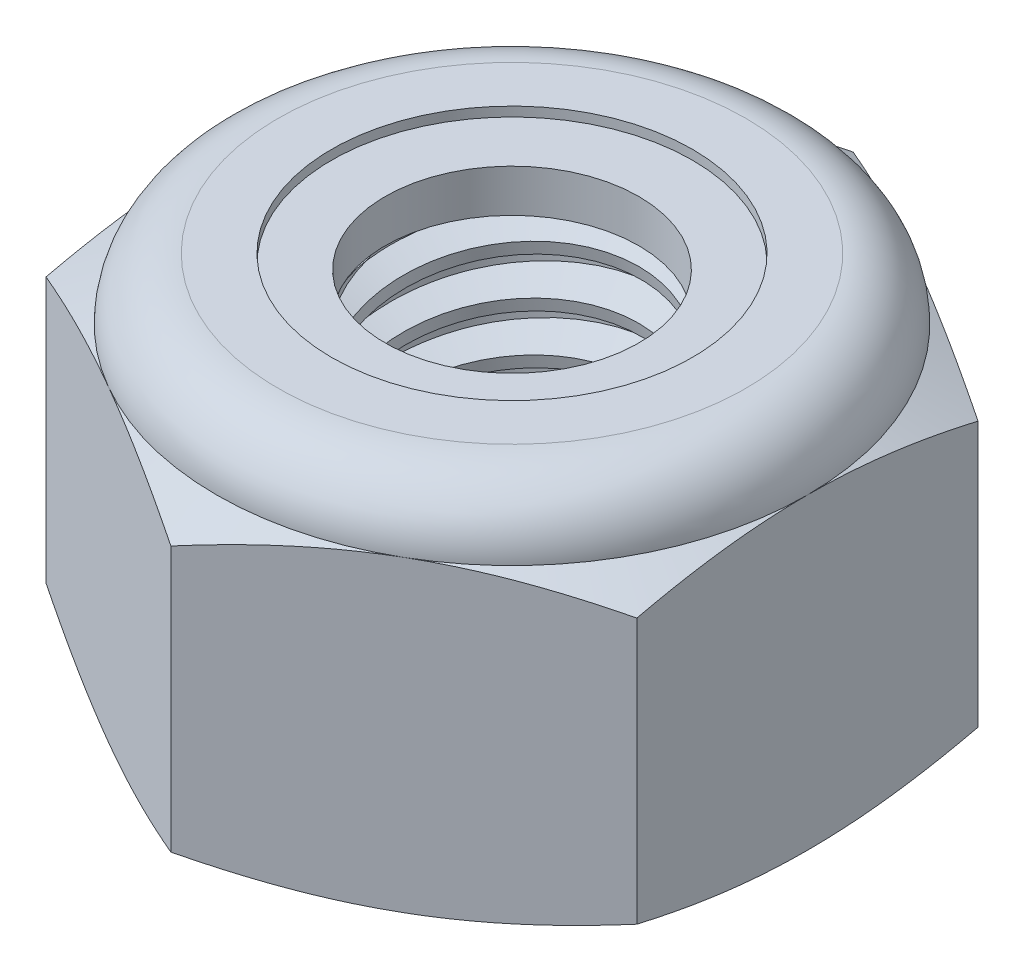
from build123d import *

# Parameters (mm, degrees)
EXTRUDE1_DEPTH       = 5.953125
SKETCH2_W            = 2.413
SKETCH2_H            = 5.953125
LPATTERN1_COUNT      = 8
LPATTERN1_PITCH      = 0.79375
LPATTERN1_COUNT_DIR2 = 2
LPATTERN1_PITCH_DIR2 = 0.79375


with BuildPart() as part:
    # Sketch1 → Extrude1 (new body)
    with BuildSketch(Plane(origin=(0, 0, 0), x_dir=(1, 0, 0), z_dir=(0, 1, 0))):
        Polygon((0, 5.499261314), (-4.7625, 2.749630657), (-4.7625, -2.749630657), (0, -5.499261314), (4.7625, -2.749630657), (4.7625, 2.749630657), align=None)
    extrude(amount=EXTRUDE1_DEPTH)

    # Sketch4 → Cut-Revolve2 (revolve, cut)
    with BuildSketch(Plane(origin=(0, 0, 0), x_dir=(0, 0, -1), z_dir=(1, 0, 0))):
        Polygon((0, 5.953125), (2.413, 5.953125), (2.045424837, 5.781721887), (2.045424837, 0.171403113), (2.413, 0), (0, 0), align=None)
    revolve(axis=Axis((0, 5.953125, 0), (0, 1, 0)), mode=Mode.SUBTRACT)


with BuildPart() as body_2:
    # Sketch2 → Revolve1 (revolve)
    with BuildSketch(Plane(origin=(0, 0, 0), x_dir=(0, 0, -1), z_dir=(1, 0, 0))):
        with Locations((1.2065, 2.9765625)):
            Rectangle(SKETCH2_W, SKETCH2_H)
    revolve(axis=Axis((0, -2.413, 0), (0, 1, 0)))

    # Sketch3 → Cut-Revolve1 (revolve, cut)
    with BuildSketch(Plane(origin=(0, 0, 0), x_dir=(0, 0, -1), z_dir=(1, 0, 0))):
        Polygon((2.429102527, 5.855221635), (2.541820218, 5.169898076), (2.077629892, 5.344930502), (2.045424837, 5.540737233), align=None)
    cut_revolve1 = revolve(axis=Axis((0, 5.953125, 0.139697061), (0, -0.9867425810390564, -0.16229318767089773)), mode=Mode.SUBTRACT)

    # LPattern1: Cut-Revolve1 8 × 2
    with Locations(*[Vector(0, -1, 0) * (i * LPATTERN1_PITCH) + Vector(0, 1, 0) * (j * LPATTERN1_PITCH_DIR2) for i in range(LPATTERN1_COUNT) for j in range(LPATTERN1_COUNT_DIR2) if (i, j) != (0, 0)]):
        add(cut_revolve1, mode=Mode.SUBTRACT)


with BuildPart() as part_1:
    add(part.part)

    # Combine1: cut body 2
    add(body_2.part, mode=Mode.SUBTRACT)

    # Sketch5 → Cut-Revolve3 (revolve, cut)
    with BuildSketch(Plane(origin=(0, 0, 0), x_dir=(0, 0, -1), z_dir=(1, 0, 0))):
        with BuildLine():
            Line((0, 0), (4.7625, 0))
            Line((4.7625, 0), (5.499261314, 0.343557443))
            Line((5.499261314, 0.343557443), (5.499261314, 4.617380057))
            Line((5.499261314, 4.617380057), (4.7625, 4.9609375))
            ThreePointArc((4.7625, 4.9609375), (4.471895009, 5.662520009), (3.7703125, 5.953125))
            Line((3.7703125, 5.953125), (3.7703125, 7.223125))
            Line((3.7703125, 7.223125), (6.769261314, 7.223125))
            Line((6.769261314, 7.223125), (6.769261314, -1.27))
            Line((6.769261314, -1.27), (0, -1.27))
            Line((0, -1.27), (0, 0))
        make_face()
    revolve(axis=Axis((0, 0, 0), (0, 1, 0)), mode=Mode.SUBTRACT)

    # Sketch6 → Cut-Revolve4 (revolve, cut)
    with BuildSketch(Plane(origin=(0, 0, 0), x_dir=(0, 0, -1), z_dir=(1, 0, 0))):
        with BuildLine():
            Line((0, 4.9609375), (4.6101, 4.9609375))
            ThreePointArc((4.6101, 4.9609375), (4.364131936, 5.554756936), (3.7703125, 5.800725))
            Line((3.7703125, 5.800725), (2.907868669, 5.800725))
            Line((2.907868669, 5.800725), (2.907868669, 7.223125))
            Line((2.907868669, 7.223125), (0, 7.223125))
            Line((0, 7.223125), (0, 4.9609375))
        make_face()
    revolve(axis=Axis((0, 7.223125, 0), (0, 1, 0)), mode=Mode.SUBTRACT)


with BuildPart() as body_2_2:
    # Sketch7 → Revolve2 (revolve)
    with BuildSketch(Plane(origin=(0, 0, 0), x_dir=(0, 0, -1), z_dir=(1, 0, 0))):
        with BuildLine():
            Line((2.045424837, 5.0371375), (4.530088408, 5.0371375))
            ThreePointArc((4.530088408, 5.0371375), (4.282601726, 5.527175629), (3.7703125, 5.724525))
            Line((3.7703125, 5.724525), (2.045424837, 5.724525))
            Line((2.045424837, 5.724525), (2.045424837, 5.0371375))
        make_face()
    revolve(axis=Axis((0, 5.0371375, 0), (0, 1, 0)))


solid = Compound([part_1.part, body_2_2.part])
